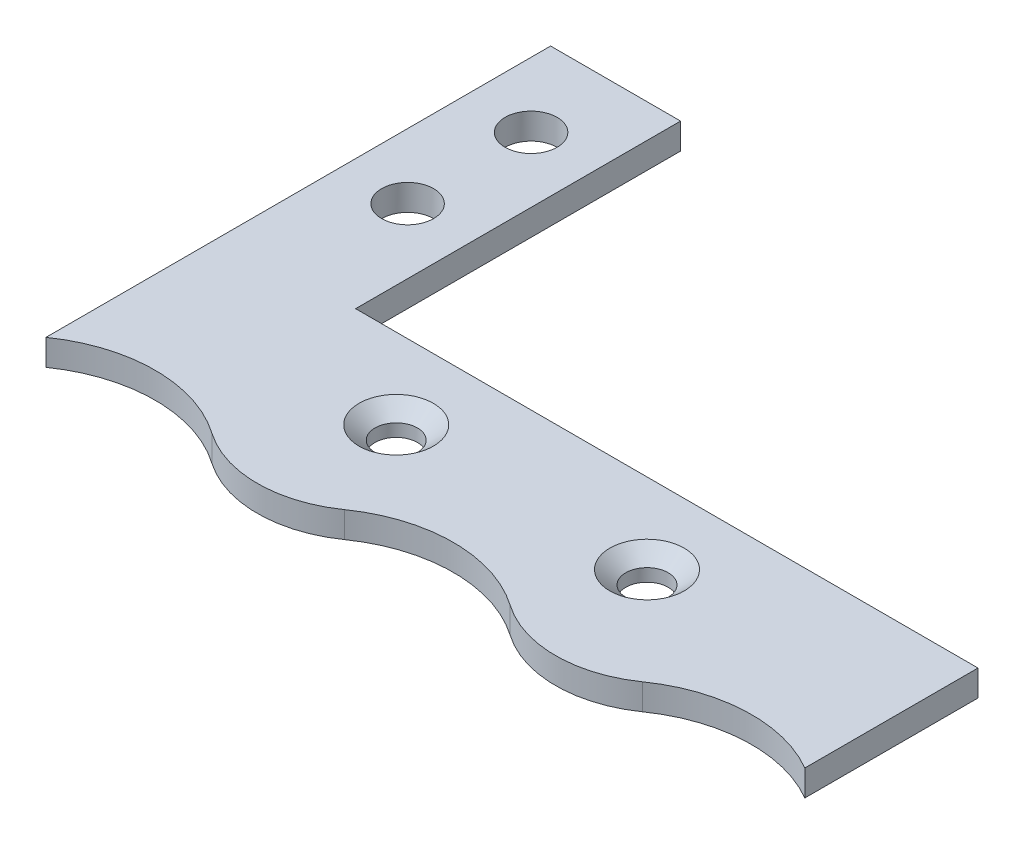
from build123d import *

# Parameters (mm, degrees)
BOSS_EXTRUDE1_DEPTH                               = 3
CONVERT_SOLID1_DEPTH                              = 1
SKETCH8_R                                         = 2
CUT_EXTRUDE1_DEPTH                                = 2
CSK_FOR_4_FLAT_HEAD_MACHINE_SCREW_100_D           = 3.2639
CSK_FOR_4_FLAT_HEAD_MACHINE_SCREW_100_DEPTH       = 2
CSK_FOR_4_FLAT_HEAD_MACHINE_SCREW_100_CSINK_D     = 5.715
CSK_FOR_4_FLAT_HEAD_MACHINE_SCREW_100_CSINK_ANGLE = 100
CSK_FOR_4_FLAT_HEAD_MACHINE_SCREW_100_TIP         = 0.980574487


# Read off the part's stored shape, not the designer's step: Convert-Solid1
with BuildPart() as part:
    # Sketch2 → Boss-Extrude1 (new body)
    with BuildSketch(Plane(origin=(0, 0, 0), x_dir=(1, 0, 0), z_dir=(0, 1, 0))):
        with BuildLine():
            Line((-29.33, 9.113793118), (-29.33, 22.932784456))
            Line((-29.33, 22.932784456), (-29.33, 47.932784456))
            Line((-29.33, 47.932784456), (-19.33, 47.932784456))
            Line((-19.33, 47.932784456), (-19.33, 22.932784456))
            Line((-19.33, 22.932784456), (28.55, 22.932784456))
            Line((28.55, 22.932784456), (28.55, 9.612784456))
            ThreePointArc((28.55, 9.612784456), (22.487022583, 11.115362203), (16.57, 9.113793118))
            ThreePointArc((16.57, 9.113793118), (11.475, 7.507664738), (6.38, 9.113793118))
            ThreePointArc((6.38, 9.113793118), (0, 11.125), (-6.38, 9.113793118))
            ThreePointArc((-6.38, 9.113793118), (-11.475, 7.507664738), (-16.57, 9.113793118))
            ThreePointArc((-16.57, 9.113793118), (-22.95, 11.125), (-29.33, 9.113793118))
        make_face()
    extrude(amount=BOSS_EXTRUDE1_DEPTH)

    # Convert-Solid1 outline → Convert-Solid1 (cut)
    with BuildSketch(Plane(origin=(0, 0, 0), x_dir=(1, 0, 0), z_dir=(0, 1, 0))):
        with BuildLine():
            Line((-29.33, 47.932784456), (-29.33, 9.113793118))
            ThreePointArc((-29.33, 9.113793118), (-22.95, 11.125), (-16.57, 9.113793118))
            ThreePointArc((-16.57, 9.113793118), (-11.475, 7.507664738), (-6.38, 9.113793118))
            ThreePointArc((-6.38, 9.113793118), (0, 11.125), (6.38, 9.113793118))
            ThreePointArc((6.38, 9.113793118), (11.475, 7.507664738), (16.57, 9.113793118))
            ThreePointArc((16.57, 9.113793118), (22.487022583, 11.115362203), (28.55, 9.612784456))
            Line((28.55, 9.612784456), (28.55, 22.932784456))
            Line((28.55, 22.932784456), (-19.33, 22.932784456))
            Line((-19.33, 22.932784456), (-19.33, 47.932784456))
            Line((-19.33, 47.932784456), (-29.33, 47.932784456))
        make_face()
    extrude(amount=CONVERT_SOLID1_DEPTH, mode=Mode.SUBTRACT)

    # Sketch8 → Cut-Extrude1 (cut)
    with BuildSketch(Plane(origin=(0, 3, 0), x_dir=(1, 0, 0), z_dir=(0, 1, 0))):
        with Locations(Location((-24.33, 41.432784456, 0), (0, 0, 270))):
            Circle(SKETCH8_R)
        with Locations(Location((-24.33, 31.932784456, 0), (0, 0, 270))):
            Circle(SKETCH8_R)
    extrude(amount=-CUT_EXTRUDE1_DEPTH, mode=Mode.SUBTRACT)

    # CSK for #4 Flat Head Machine Screw (100)1
    with Locations(Plane(origin=(0, 3, 0), x_dir=(1, 0, 0), z_dir=(0, 1, 0))):
        with Locations((9.256666667, 16.762784456), (-10.036666667, 16.762784456)):
            CounterSinkHole(CSK_FOR_4_FLAT_HEAD_MACHINE_SCREW_100_D / 2, CSK_FOR_4_FLAT_HEAD_MACHINE_SCREW_100_CSINK_D / 2, depth=CSK_FOR_4_FLAT_HEAD_MACHINE_SCREW_100_DEPTH, counter_sink_angle=CSK_FOR_4_FLAT_HEAD_MACHINE_SCREW_100_CSINK_ANGLE)
            with Locations((0, 0, -(CSK_FOR_4_FLAT_HEAD_MACHINE_SCREW_100_DEPTH + CSK_FOR_4_FLAT_HEAD_MACHINE_SCREW_100_TIP / 2))):  # 118° drill point
                Cone(0, CSK_FOR_4_FLAT_HEAD_MACHINE_SCREW_100_D / 2, CSK_FOR_4_FLAT_HEAD_MACHINE_SCREW_100_TIP, mode=Mode.SUBTRACT)


solid = part.part
